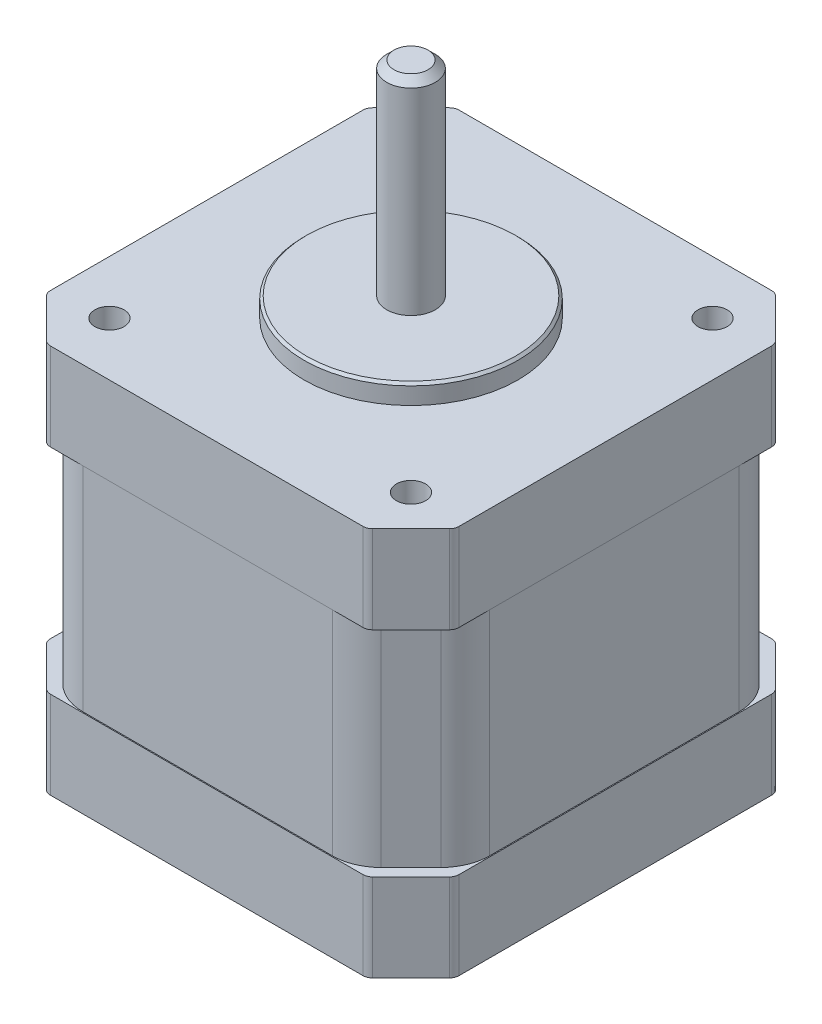
from build123d import *

# Parameters (mm, degrees)
BOSS_EXTRUDE1_DEPTH = 9
BOSS_EXTRUDE4_DEPTH = 22
BOSS_EXTRUDE5_DEPTH = 9
SKETCH5_R           = 11
BOSS_EXTRUDE6_DEPTH = 2
CHAMFER1_SIZE       = 0.25
SKETCH6_R           = 2.5
BOSS_EXTRUDE7_DEPTH = 21
CHAMFER2_SIZE       = 0.75
FILLET2_R           = 1
FILLET3_R           = 5
SKETCH7_R           = 4.5
CUT_EXTRUDE1_DEPTH  = 3
SKETCH8_R           = 1.5
CUT_EXTRUDE2_DEPTH  = 50.819674828
SKETCH9_R           = 3
CUT_EXTRUDE3_DEPTH  = 1.3


with BuildPart() as part:
    # Sketch1 → Boss-Extrude1 (new body)
    with BuildSketch(Plane(origin=(0, 0, 0), x_dir=(1, 0, 0), z_dir=(0, 1, 0))):
        Polygon((-16.476659403, 21), (-21, 16.476659403), (-21, -16.476659403), (-16.476659403, -21), (16.476659403, -21), (21, -16.476659403), (21, 16.476659403), (16.476659403, 21), align=None)
    extrude(amount=BOSS_EXTRUDE1_DEPTH)

    # Sketch2 → Boss-Extrude4 (add)
    with BuildSketch(Plane(origin=(0, 9, 0), x_dir=(1, 0, 0), z_dir=(0, 1, 0))):
        Polygon((14.9, -20.9), (-14.9, -20.9), (-20.9, -14.9), (-20.9, 14.9), (-14.9, 20.9), (14.9, 20.9), (20.9, 14.9), (20.9, -14.9), align=None)
    extrude(amount=BOSS_EXTRUDE4_DEPTH)

    # Sketch4 → Boss-Extrude5 (add)
    with BuildSketch(Plane(origin=(0, 31, 0), x_dir=(1, 0, 0), z_dir=(0, 1, 0))):
        Polygon((16.476659403, -21), (-16.476659403, -21), (-21, -16.476659403), (-21, 16.476659403), (-16.476659403, 21), (16.476659403, 21), (21, 16.476659403), (21, -16.476659403), align=None)
    extrude(amount=BOSS_EXTRUDE5_DEPTH)

    # Sketch5 → Boss-Extrude6 (add)
    with BuildSketch(Plane(origin=(0, 40, 0), x_dir=(1, 0, 0), z_dir=(0, 1, 0))):
        Circle(SKETCH5_R)
    extrude(amount=BOSS_EXTRUDE6_DEPTH)

    # Chamfer1
    chamfer1_edges = [part.edges().sort_by_distance(p)[0] for p in [
        (-11, 42, 0),
    ]]
    chamfer(chamfer1_edges, length=CHAMFER1_SIZE)

    # Sketch6 → Boss-Extrude7 (add)
    with BuildSketch(Plane(origin=(0, 42, 0), x_dir=(1, 0, 0), z_dir=(0, 1, 0))):
        Circle(SKETCH6_R)
    extrude(amount=BOSS_EXTRUDE7_DEPTH)

    # Chamfer2
    chamfer2_edges = [part.edges().sort_by_distance(p)[0] for p in [
        (-2.5, 63, 0),
    ]]
    chamfer(chamfer2_edges, length=CHAMFER2_SIZE)

    # Fillet2
    fillet2_edges = [part.edges().sort_by_distance(p)[0] for p in [
        (16.476659403, 4.5, -21),
        (21, 4.5, -16.476659403),
        (21, 4.5, 16.476659403),
        (16.476659403, 4.5, 21),
        (-16.476659403, 4.5, 21),
        (-21, 4.5, 16.476659403),
        (-16.476659403, 4.5, -21),
        (-21, 4.5, -16.476659403),
        (-16.476659403, 35.5, -21),
        (-21, 35.5, -16.476659403),
        (16.476659403, 35.5, -21),
        (21, 35.5, -16.476659403),
        (21, 35.5, 16.476659403),
        (16.476659403, 35.5, 21),
        (-16.476659403, 35.5, 21),
        (-21, 35.5, 16.476659403),
    ]]
    fillet(fillet2_edges, radius=FILLET2_R)

    # Fillet3
    fillet3_edges = [part.edges().sort_by_distance(p)[0] for p in [
        (-14.9, 20, 20.9),
        (-20.9, 20, 14.9),
        (-20.9, 20, -14.9),
        (-14.9, 20, -20.9),
        (14.9, 20, -20.9),
        (20.9, 20, -14.9),
        (20.9, 20, 14.9),
        (14.9, 20, 20.9),
    ]]
    fillet(fillet3_edges, radius=FILLET3_R)

    # Sketch7 → Cut-Extrude1 (cut)
    with BuildSketch(Plane.XZ):
        Circle(SKETCH7_R)
    extrude(amount=-CUT_EXTRUDE1_DEPTH, mode=Mode.SUBTRACT)

    # Sketch8 → Cut-Extrude2 (cut, through all)
    with BuildSketch(Plane(origin=(0, 40, 0), x_dir=(1, 0, 0), z_dir=(0, 1, 0))):
        with Locations((-15.5, -15.5)):
            Circle(SKETCH8_R)
        with Locations((-15.5, 15.5)):
            Circle(SKETCH8_R)
        with Locations((15.5, 15.5)):
            Circle(SKETCH8_R)
        with Locations((15.5, -15.5)):
            Circle(SKETCH8_R)
    extrude(amount=-CUT_EXTRUDE2_DEPTH, mode=Mode.SUBTRACT)

    # Sketch9 → Cut-Extrude3 (cut)
    with BuildSketch(Plane.XZ):
        with Locations((-15.5, 15.5)):
            Circle(SKETCH9_R)
        with Locations((15.5, 15.5)):
            Circle(SKETCH9_R)
        with Locations((-15.5, -15.5)):
            Circle(SKETCH9_R)
        with Locations((15.5, -15.5)):
            Circle(SKETCH9_R)
    extrude(amount=-CUT_EXTRUDE3_DEPTH, mode=Mode.SUBTRACT)


solid = part.part
